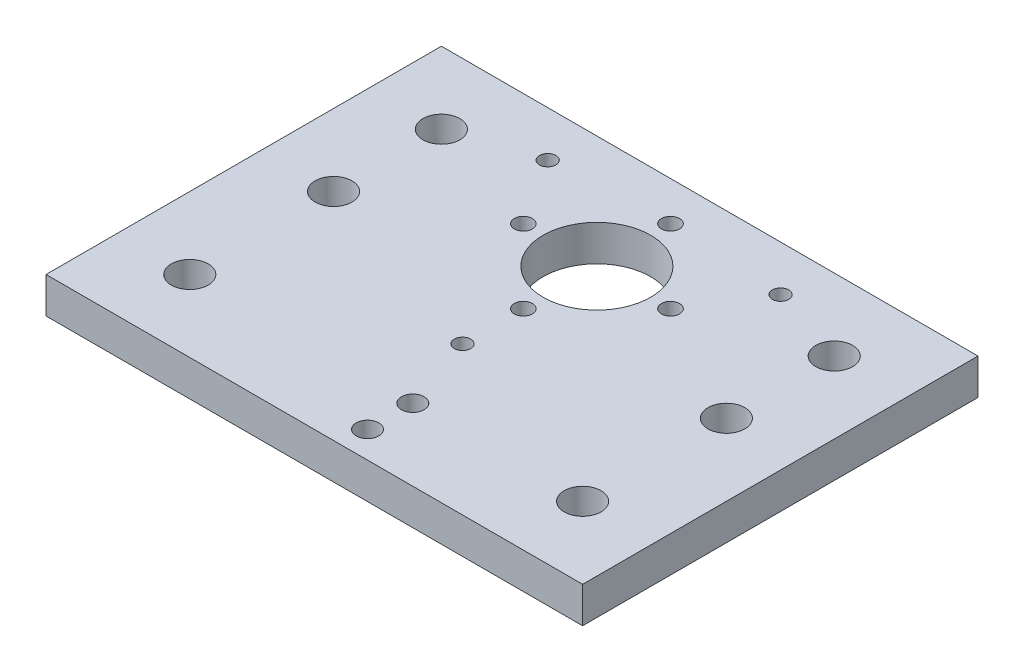
from build123d import *

# Parameters (mm, degrees)
SKETCH1_W                                       = 94.8
SKETCH1_H                                       = 69.85
SKETCH1_R                                       = 3.25755
SKETCH1_R_2                                     = 2
SKETCH1_R_3                                     = 9.5
SKETCH1_R_4                                     = 1.45
BOSS_EXTRUDE1_DEPTH                             = 6.35
CSK_FOR_M3_FLAT_HEAD_MACHINE_SCREW1_D           = 3.2
CSK_FOR_M3_FLAT_HEAD_MACHINE_SCREW1_CSINK_D     = 6.3
CSK_FOR_M3_FLAT_HEAD_MACHINE_SCREW1_CSINK_ANGLE = 90


with BuildPart() as part:
    # Sketch1 → Boss-Extrude1 (new body)
    with BuildSketch(Plane(origin=(0, 0, 0), x_dir=(1, 0, 0), z_dir=(0, 1, 0))):
        Rectangle(SKETCH1_W, SKETCH1_H)
        with Locations((-34.7, 22.225)):
            Circle(SKETCH1_R, mode=Mode.SUBTRACT)
        with Locations((34.7, 22.225)):
            Circle(SKETCH1_R, mode=Mode.SUBTRACT)
        with Locations((34.7, -22.225)):
            Circle(SKETCH1_R, mode=Mode.SUBTRACT)
        with Locations((-34.7, -22.225)):
            Circle(SKETCH1_R, mode=Mode.SUBTRACT)
        with Locations((4.7, -30.225)):
            Circle(SKETCH1_R_2, mode=Mode.SUBTRACT)
        with Locations((4.7, -22.225)):
            Circle(SKETCH1_R_2, mode=Mode.SUBTRACT)
        with Locations((0, 15)):
            Circle(SKETCH1_R_3, mode=Mode.SUBTRACT)
        with Locations((-34.7, 3.175)):
            Circle(SKETCH1_R, mode=Mode.SUBTRACT)
        with Locations((34.7, 3.175)):
            Circle(SKETCH1_R, mode=Mode.SUBTRACT)
        with Locations((0, -8.75)):
            Circle(SKETCH1_R_4, mode=Mode.SUBTRACT)
        with Locations((-20.56810334, 26.875)):
            Circle(SKETCH1_R_4, mode=Mode.SUBTRACT)
        with Locations((20.56810334, 26.875)):
            Circle(SKETCH1_R_4, mode=Mode.SUBTRACT)
    extrude(amount=BOSS_EXTRUDE1_DEPTH)

    # CSK for M3 Flat Head Machine Screw1 (through all)
    with Locations(Plane(origin=(0, 0, 0), x_dir=(-1, 0, 0), z_dir=(0, -1, 0))):
        with Locations((-13, 15), (0, 2), (13, 15), (0, 28)):
            CounterSinkHole(CSK_FOR_M3_FLAT_HEAD_MACHINE_SCREW1_D / 2, CSK_FOR_M3_FLAT_HEAD_MACHINE_SCREW1_CSINK_D / 2, counter_sink_angle=CSK_FOR_M3_FLAT_HEAD_MACHINE_SCREW1_CSINK_ANGLE)


solid = part.part
